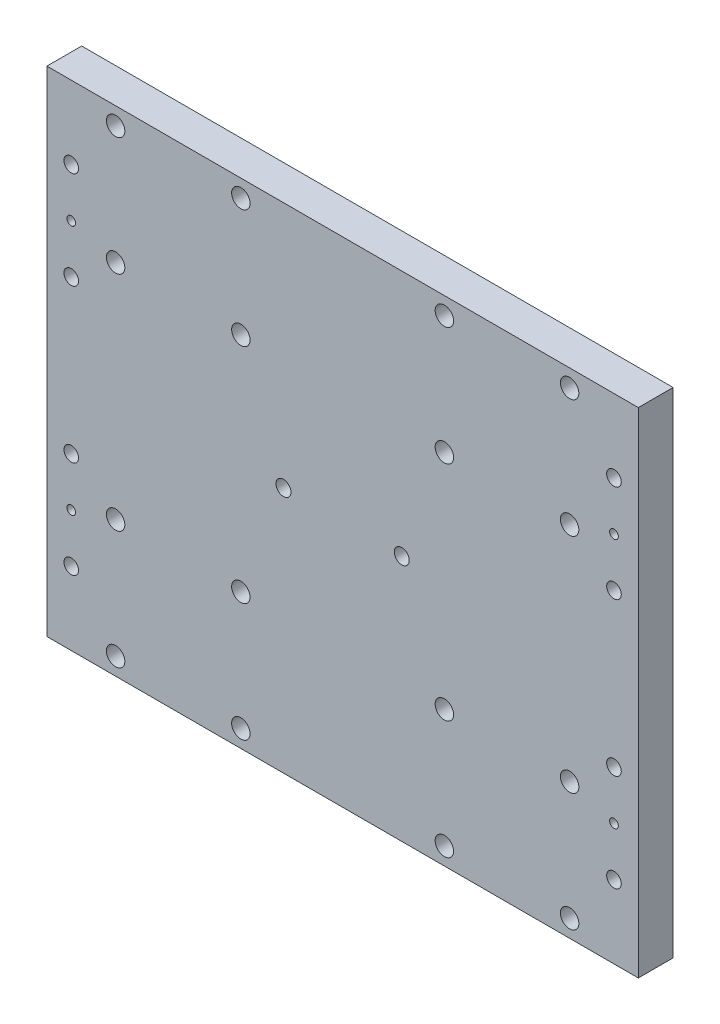
from build123d import *

# Parameters (mm, degrees)
SKETCH1_W                      = 170
SKETCH1_H                      = 142
BOSS_EXTRUDE1_DEPTH            = 5
M5_CLEARANCE_HOLE1_D           = 5.3
MIRROR3_COPY_1_D               = 5.3
MIRROR3_COPY_2_D               = 5.3
M4_CLEARANCE_HOLE1_D           = 4.3
M5X0_8_TAPPED_HOLE1_AT_2_COUNT = 2
M5X0_8_TAPPED_HOLE1_AT_2_PITCH = 28
SKETCH6_R                      = 1.25
CUT_EXTRUDE5_DEPTH             = 112.202517957
MIRROR4_COPY_2_SKETCH_R        = 1.25
MIRROR4_COPY_2_DEPTH           = 112.202517957
MIRROR4_COPY_5_SKETCH_R        = 1.25
MIRROR4_COPY_5_DEPTH           = 112.202517957


with BuildPart() as part:
    # Sketch1 → Boss-Extrude1 (new, symmetric)
    with BuildSketch(Plane.XY):
        Rectangle(SKETCH1_W, SKETCH1_H)
    extrude(amount=BOSS_EXTRUDE1_DEPTH, both=True)

    # M5 Clearance Hole1 (through all)
    with Locations(Plane.XY.offset(5)):
        with Locations((-65.25, 66), (-29.25, 66), (-29.25, 32), (-65.25, 32)):
            m5_clearance_hole1 = Hole(M5_CLEARANCE_HOLE1_D / 2)

    # Mirror2: M5 Clearance Hole1 across plane
    add(m5_clearance_hole1.mirror(Plane.ZX), mode=Mode.SUBTRACT)

    # Mirror3 copy 1 (through all)
    with Locations(Plane(origin=(0, 0, 5), x_dir=(-1, 0, 0), z_dir=(0, 0, 1))):
        with Locations((-65.25, 66), (-29.25, 66), (-29.25, 32), (-65.25, 32)):
            Hole(MIRROR3_COPY_1_D / 2)

    # Mirror3 copy 2 (through all)
    with Locations(Plane(origin=(0, 0, 5), x_dir=(-1, 0, 0), z_dir=(0, 0, 1))):
        with Locations((-65.25, -66), (-29.25, -66), (-29.25, -32), (-65.25, -32)):
            Hole(MIRROR3_COPY_2_D / 2)

    # M4 Clearance Hole1 (through all)
    with Locations(Plane.XY.offset(5)):
        with Locations((-17, 0), (17, 0)):
            Hole(M4_CLEARANCE_HOLE1_D / 2)

    # Sketch11 → M5x0.8 Tapped Hole1 (revolve, cut)
    with BuildSketch(Plane(origin=(-78, 50, 5), x_dir=(0, -1, 0), z_dir=(1, 0, 0))):
        Polygon((0, 0), (0, 15.2618073), (2.1, 14), (2.1, 0), align=None)
    m5x0_8_tapped_hole1 = revolve(axis=Axis((-78, 50, 11.35), (0, 0, -1)), mode=Mode.SUBTRACT)

    # M5x0.8 Tapped Hole1 at 2: M5x0.8 Tapped Hole1 ×2
    with Locations(*[(0, -i * M5X0_8_TAPPED_HOLE1_AT_2_PITCH, 0) for i in range(1, M5X0_8_TAPPED_HOLE1_AT_2_COUNT)]):
        add(m5x0_8_tapped_hole1, mode=Mode.SUBTRACT)

    # Sketch6 → Cut-Extrude5 (cut, through all)
    with BuildSketch(Plane.XY.offset(5)):
        with Locations((-78, 36)):
            Circle(SKETCH6_R)
    cut_extrude5 = extrude(amount=-CUT_EXTRUDE5_DEPTH, mode=Mode.SUBTRACT)

    # Mirror1: M5x0.8 Tapped Hole1, Cut-Extrude5 across plane
    add(m5x0_8_tapped_hole1.mirror(Plane(origin=(0, 0, 0), x_dir=(0, 0, 1), z_dir=(1, 0, 0))), mode=Mode.SUBTRACT)
    add(cut_extrude5.mirror(Plane(origin=(0, 0, 0), x_dir=(0, 0, 1), z_dir=(1, 0, 0))), mode=Mode.SUBTRACT)

    # Mirror1 copy 1 sketch → Mirror1 copy 1 (revolve, cut)
    with BuildSketch(Plane(origin=(78, 22, 5), x_dir=(0, -1, 0), z_dir=(-1, 0, 0))):
        Polygon((0, 0), (0, -15.2618073), (2.1, -14), (2.1, 0), align=None)
    revolve(axis=Axis((78, 22, 11.35), (0, 0, 1)), mode=Mode.SUBTRACT)

    # Mirror4 copy 1 sketch → Mirror4 copy 1 (revolve, cut)
    with BuildSketch(Plane(origin=(78, -50, 5), x_dir=(0, 1, 0), z_dir=(-1, 0, 0))):
        Polygon((0, 0), (0, 15.2618073), (2.1, 14), (2.1, 0), align=None)
    revolve(axis=Axis((78, -50, 11.35), (0, 0, -1)), mode=Mode.SUBTRACT)

    # Mirror4 copy 2 sketch → Mirror4 copy 2 (cut, through all)
    with BuildSketch(Plane(origin=(0, 0, 5), x_dir=(-1, 0, 0), z_dir=(0, 0, 1))):
        with Locations((-78, 36)):
            Circle(MIRROR4_COPY_2_SKETCH_R)
    extrude(amount=-MIRROR4_COPY_2_DEPTH, mode=Mode.SUBTRACT)

    # Mirror4 copy 3 sketch → Mirror4 copy 3 (revolve, cut)
    with BuildSketch(Plane(origin=(78, -22, 5), x_dir=(0, 1, 0), z_dir=(-1, 0, 0))):
        Polygon((0, 0), (0, 15.2618073), (2.1, 14), (2.1, 0), align=None)
    revolve(axis=Axis((78, -22, 11.35), (0, 0, -1)), mode=Mode.SUBTRACT)

    # Mirror4 copy 4 sketch → Mirror4 copy 4 (revolve, cut)
    with BuildSketch(Plane(origin=(-78, -50, 5), x_dir=(0, 1, 0), z_dir=(1, 0, 0))):
        Polygon((0, 0), (0, -15.2618073), (2.1, -14), (2.1, 0), align=None)
    revolve(axis=Axis((-78, -50, 11.35), (0, 0, 1)), mode=Mode.SUBTRACT)

    # Mirror4 copy 5 sketch → Mirror4 copy 5 (cut, through all)
    with BuildSketch(Plane.XY.offset(5)):
        with Locations((-78, -36)):
            Circle(MIRROR4_COPY_5_SKETCH_R)
    extrude(amount=-MIRROR4_COPY_5_DEPTH, mode=Mode.SUBTRACT)

    # Mirror4 copy 6 sketch → Mirror4 copy 6 (revolve, cut)
    with BuildSketch(Plane(origin=(-78, -22, 5), x_dir=(0, 1, 0), z_dir=(1, 0, 0))):
        Polygon((0, 0), (0, -15.2618073), (2.1, -14), (2.1, 0), align=None)
    revolve(axis=Axis((-78, -22, 11.35), (0, 0, 1)), mode=Mode.SUBTRACT)


solid = part.part
